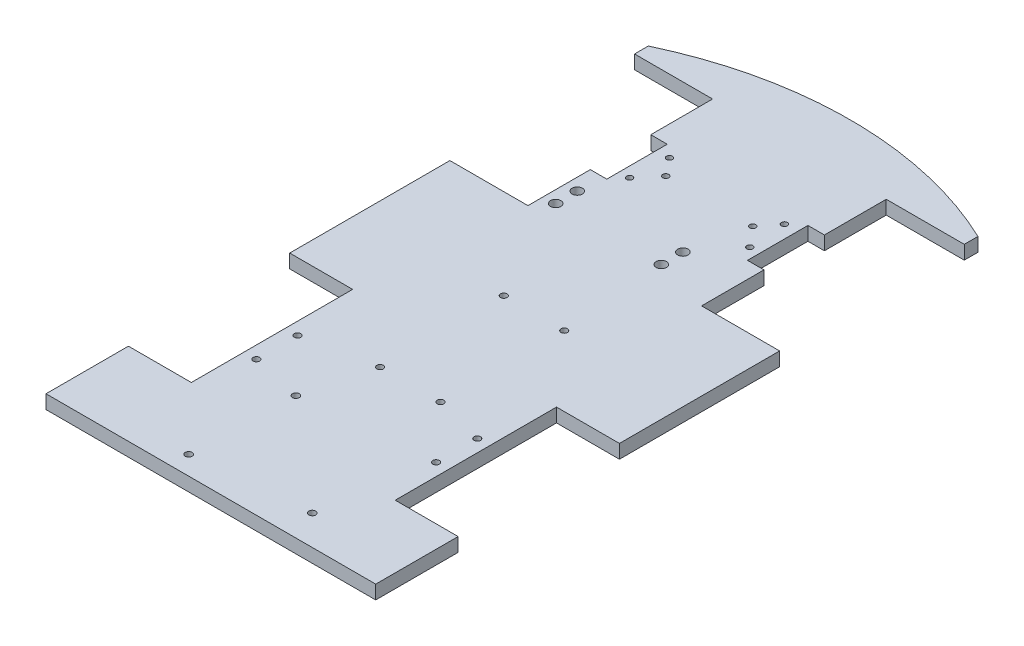
from build123d import *

# Parameters (mm, degrees)
CHASSIS_DEPTH      = 6.35
SKETCH2_R          = 1.5875
SKETCH2_R_2        = 1.3716
SKETCH2_R_3        = 2.38125
SKETCH2_R_4        = 1.5
CUT_EXTRUDE1_DEPTH = 17.78


with BuildPart() as part:
    # Sketch1 → Chassis (new body)
    with BuildSketch(Plane(origin=(0, 0, 0), x_dir=(1, 0, 0), z_dir=(0, 1, 0))):
        with BuildLine():
            ThreePointArc((76.2, 49.022), (39.053241005, 61.832834411), (0, 66.173750115))
            Line((0, 66.173750115), (0, -229.362))
            Line((0, -229.362), (76.2, -229.362))
            Line((76.2, -229.362), (76.2, -191.262))
            Line((76.2, -191.262), (47.117, -191.262))
            Line((47.117, -191.262), (47.117, -116.713))
            Line((47.117, -116.713), (76.2, -116.713))
            Line((76.2, -116.713), (76.2, -42.672))
            Line((76.2, -42.672), (40.132, -42.672))
            Line((40.132, -42.672), (40.132, -13.843))
            Line((40.132, -13.843), (32.512, -13.843))
            Line((32.512, -13.843), (32.512, 14.097))
            Line((32.512, 14.097), (40.132, 14.097))
            Line((40.132, 14.097), (40.132, 42.672))
            Line((40.132, 42.672), (76.2, 42.672))
            Line((76.2, 42.672), (76.2, 49.022))
        make_face()
    chassis = extrude(amount=CHASSIS_DEPTH)

    # Mirror1: Chassis across plane
    add(chassis.mirror(Plane(origin=(0, 6.35, 0), x_dir=(0, 0, 1), z_dir=(1, 0, 0))))

    # Sketch2 → Cut-Extrude1 (cut)
    with BuildSketch(Plane(origin=(0, 0, 0), x_dir=(1, 0, 0), z_dir=(0, 1, 0))):
        with Locations((-17.703140953, -172.359887538)):
            Circle(SKETCH2_R)
        with Locations((-18.973140953, -220.619887538)):
            Circle(SKETCH2_R)
        with Locations((33.096859047, -215.539887538)):
            Circle(SKETCH2_R)
        with Locations((-26.555704526, 9.169971692)):
            Circle(SKETCH2_R_2)
        with Locations((-20.105647723, 0.999384842)):
            Circle(SKETCH2_R_2)
        with Locations((-27.786476371, -8.040568412)):
            Circle(SKETCH2_R_2)
        with Locations((26.555704526, 9.169971692)):
            Circle(SKETCH2_R_2)
        with Locations((20.105647723, 0.999384842)):
            Circle(SKETCH2_R_2)
        with Locations((27.786476371, -8.040568412)):
            Circle(SKETCH2_R_2)
        with Locations((14.2672, -25.46003476)):
            Circle(SKETCH2_R_3)
        with Locations((14.2672, -35.42953476)):
            Circle(SKETCH2_R_3)
        with Locations((-34.5516, -25.46003476)):
            Circle(SKETCH2_R_3)
        with Locations((-34.5516, -35.42953476)):
            Circle(SKETCH2_R_3)
        with Locations((18.288, -84.328)):
            Circle(SKETCH2_R_4)
        with Locations((-9.652, -84.328)):
            Circle(SKETCH2_R_4)
        with Locations((18.288, -141.478)):
            Circle(SKETCH2_R_4)
        with Locations((-9.652, -141.478)):
            Circle(SKETCH2_R_4)
        with Locations((-41.402, -147.875000023)):
            Circle(SKETCH2_R_4)
        with Locations((-41.402, -166.925000023)):
            Circle(SKETCH2_R_4)
        with Locations((41.402, -147.605334461)):
            Circle(SKETCH2_R_4)
        with Locations((41.402, -166.655334461)):
            Circle(SKETCH2_R_4)
    extrude(amount=CUT_EXTRUDE1_DEPTH, mode=Mode.SUBTRACT)


solid = part.part
